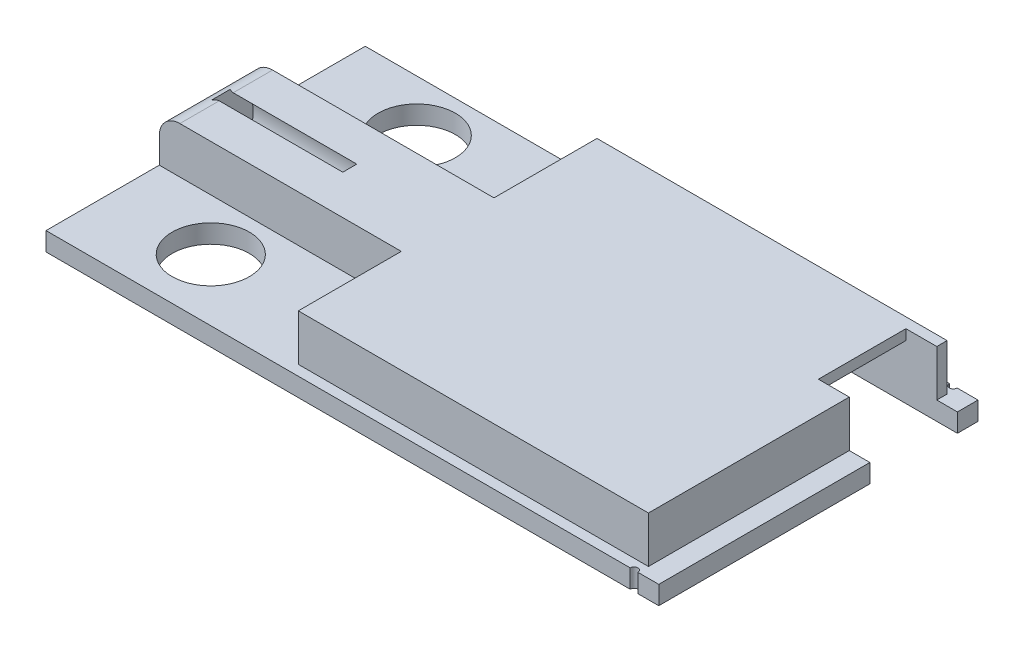
from build123d import *

# Parameters (mm, degrees)
RESSALTO_EXTRUS_O1_DEPTH      = 3
RESSALTO_EXTRUS_O1_DEPTH_BACK = 0.6
ESBO_O1_W                     = 119
ESBO_O1_H                     = 62
ESBO_O1_R                     = 7.5
RESSALTO_EXTRUS_O2_DEPTH      = 9
CORTE_EXTRUS_O1_START         = -2
CORTE_EXTRUS_O1_DEPTH         = 133.772994327
ESBO_O4_R                     = 3
CORTE_EXTRUS_O2_DEPTH         = 28
CORTE_EXTRUS_O3_START         = -3
ESBO_O4_4_R                   = 6.25
ESBO_O4_4_R_2                 = 3
CORTE_EXTRUS_O3_DEPTH         = 25
ESBO_O6_R                     = 0.75
CORTE_EXTRUS_O5_DEPTH         = 3.6
CORTE_EXTRUS_O6_REACH         = 136.773
ESBO_O7_W                     = 10
ESBO_O7_H                     = 17
FILETE1_R                     = 4


with BuildPart() as part:
    # Esboço1 → Ressalto-extrusão1 (new, two sides: drawn at the far end of the back side and taken through both)
    with BuildSketch(Plane(origin=(0, 0, 0), x_dir=(1, 0, 0), z_dir=(0, 1, 0)).offset(-RESSALTO_EXTRUS_O1_DEPTH_BACK)):
        with Locations((59.5, 31)):
            Rectangle(ESBO_O1_W, ESBO_O1_H)
        with Locations(Location((20, 52, 0), (0, 0, 270))):
            Circle(ESBO_O1_R, mode=Mode.SUBTRACT)
        with Locations(Location((20, 12, 0), (0, 0, 270))):
            Circle(ESBO_O1_R, mode=Mode.SUBTRACT)
    extrude(amount=RESSALTO_EXTRUS_O1_DEPTH + RESSALTO_EXTRUS_O1_DEPTH_BACK)

    # Esboço2 → Ressalto-extrusão2 (add)
    with BuildSketch(Plane(origin=(0, 3, 0), x_dir=(1, 0, 0), z_dir=(0, 1, 0))):
        Polygon((47, 2), (115, 2), (115, 60), (47, 60), (47, 40), (0, 40), (0, 22), (47, 22), align=None)
    extrude(amount=RESSALTO_EXTRUS_O2_DEPTH)

    # Esboço3 → Corte-extrusão1 (cut, through all)
    with BuildSketch(Plane(origin=(0, 12, 0), x_dir=(1, 0, 0), z_dir=(0, 1, 0)).offset(CORTE_EXTRUS_O1_START)):
        Polygon((49, 58), (113, 58), (113, 4), (49, 4), (49, 25), (3, 25), (3, 37), (49, 37), align=None)
    extrude(amount=-CORTE_EXTRUS_O1_DEPTH, mode=Mode.SUBTRACT)

    # Esboço4 → Corte-extrusão2 (cut)
    with BuildSketch(Plane.ZY):
        with Locations((-31, 5.9)):
            Circle(ESBO_O4_R)
    extrude(amount=-CORTE_EXTRUS_O2_DEPTH, mode=Mode.SUBTRACT)

    # Esboço4<4> → Corte-extrusão3 (cut)
    with BuildSketch(Plane.ZY.offset(CORTE_EXTRUS_O3_START)):
        with Locations((-31, 5.9)):
            Circle(ESBO_O4_4_R)
        with Locations((-31, 5.9)):
            Circle(ESBO_O4_4_R_2, mode=Mode.SUBTRACT)
    extrude(amount=-CORTE_EXTRUS_O3_DEPTH, mode=Mode.SUBTRACT)

    # Esboço6 → Corte-extrusão5 (cut)
    with BuildSketch(Plane.XZ.offset(0.6)):
        with Locations((114.2, 0)):
            Circle(ESBO_O6_R)
        with Locations((114.2, -62)):
            Circle(ESBO_O6_R)
    extrude(amount=-CORTE_EXTRUS_O5_DEPTH, mode=Mode.SUBTRACT)

    # Corte-extrusão6: up to this face of the body (flat: up to its plane)
    corte_extrus_o6_end = Plane(part.part.faces().sort_by_distance((71.642099046, 12, -31))[0])
    # Esboço7 → Corte-extrusão6 (cut, up to the picked face)
    with BuildSketch(Plane(origin=(0, -0.6, 0), x_dir=(-1, 0, 0), z_dir=(0, -1, 0)), mode=Mode.PRIVATE) as corte_extrus_o6_sk1:
        with Locations((-114, 49.5)):
            Rectangle(ESBO_O7_W, ESBO_O7_H)
    corte_extrus_o6_tool1 = split(extrude(corte_extrus_o6_sk1.sketch, amount=-CORTE_EXTRUS_O6_REACH, mode=Mode.PRIVATE), bisect_by=corte_extrus_o6_end, keep=Keep.BOTH, mode=Mode.PRIVATE)
    add(corte_extrus_o6_tool1.solids().sort_by(Axis((114, -0.6, -49.5), (0, 1, 0)))[0], mode=Mode.SUBTRACT)

    # Filete1
    # the kernel refuses this fillet: 4 mm, written as the material it takes off along each edge
    with BuildSketch(Plane(origin=(0, 12, -50), x_dir=(1, 0, 0), z_dir=(0, 0, 1))) as filete1_piece_1:
        with BuildLine():
            CenterArc((FILETE1_R, -FILETE1_R), FILETE1_R, 90, 90)
            Line((0, -FILETE1_R), (0, 0))
            Line((0, 0), (FILETE1_R, 0))
        make_face()
    extrude(amount=38, mode=Mode.SUBTRACT)


solid = part.part
